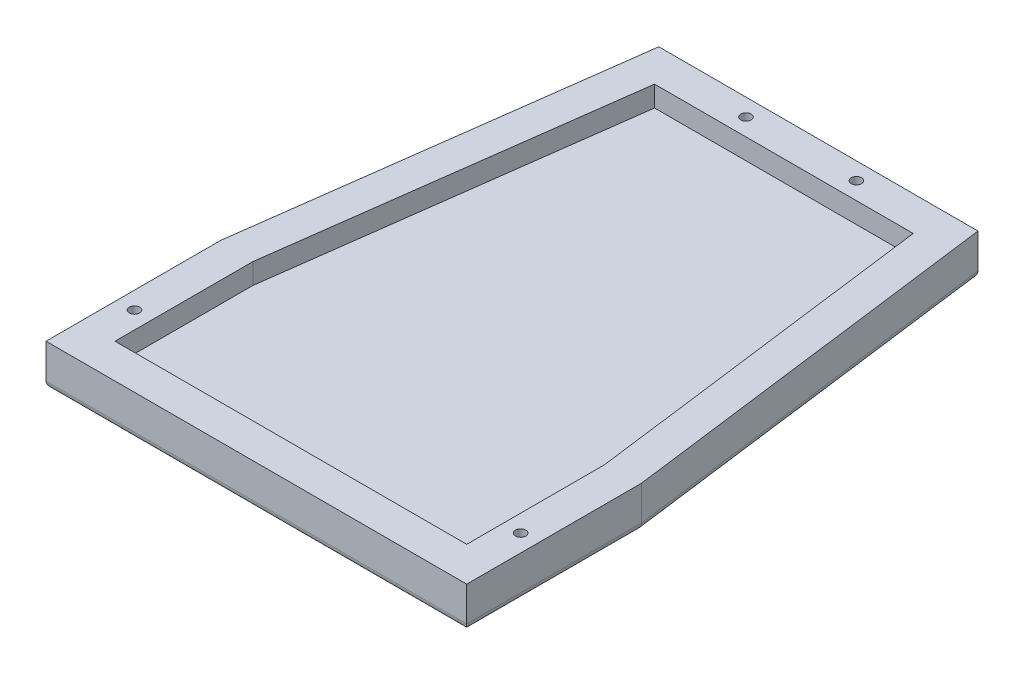
from build123d import *

# Parameters (mm, degrees)
DODANIE_WYCI_GNI_CIE1_DEPTH       = 3
WYCI_GNI_CIE_CIENKA_CIANKA1_DEPTH = 6
WYTNIJ_WYCI_GNI_CIE1_DEPTH        = 51
WYTNIJ_WYCI_GNI_CIE1_DEPTH_BACK   = 39
SZKIC5_R                          = 0.75
ZAOKR_GLENIE1_R                   = 1


with BuildPart() as part:
    # Szkic1 → Dodanie-wyciągnięcie1 (new body)
    with BuildSketch(Plane(origin=(0, 0, 0), x_dir=(1, 0, 0), z_dir=(0, 1, 0))):
        Polygon((-46.22519084, 44.98778626), (-0.22519084, 44.98778626), (7.27480916, -12.885496183), (7.27480916, -36.41221374), (-53.72519084, -36.41221374), (-53.72519084, -11.41221374), align=None)
    extrude(amount=DODANIE_WYCI_GNI_CIE1_DEPTH)

    # Szkic3 → Wyciągnięcie-cienka ścianka1 (add)
    with BuildSketch(Plane(origin=(0, 0, 0), x_dir=(1, 0, 0), z_dir=(0, 1, 0))):
        Polygon((7.27480916, -11.089579023), (0.007548313, 44.98778626), (-46.269205463, 44.98778626), (-53.72519084, -11.081223772), (-53.72519084, -36.41221374), (7.27480916, -36.41221374), align=None)
        Polygon((2.27480916, -11.41221374), (-4.386295649, 39.98778626), (-41.890084457, 39.98778626), (-48.72519084, -11.41221374), (-48.72519084, -31.41221374), (2.27480916, -31.41221374), align=None, mode=Mode.SUBTRACT)
    extrude(amount=WYCI_GNI_CIE_CIENKA_CIANKA1_DEPTH)

    # Szkic5 → Wytnij-wyciągnięcie1 (cut, two sides: drawn at the far end of the back side and taken through both)
    with BuildSketch(Plane(origin=(0, 6, 0), x_dir=(1, 0, 0), z_dir=(0, 1, 0)).offset(-WYTNIJ_WYCI_GNI_CIE1_DEPTH_BACK)):
        with Locations(Location((-31.129205463, 42.48778626, 0), (0, 0, 90))):
            Circle(SZKIC5_R)
        with Locations(Location((-15.129205463, 42.48778626, 0), (0, 0, 90))):
            Circle(SZKIC5_R)
        with Locations(Location((-51.22519084, -26.081223772, 0), (0, 0, 90))):
            Circle(SZKIC5_R)
        with Locations(Location((4.77480916, -26.089579023, 0), (0, 0, 90))):
            Circle(SZKIC5_R)
    extrude(amount=WYTNIJ_WYCI_GNI_CIE1_DEPTH + WYTNIJ_WYCI_GNI_CIE1_DEPTH_BACK, mode=Mode.SUBTRACT)

    # Zaokrąglenie1
    # the kernel refuses this fillet: 1 mm, written as the material it takes off along each edge
    with BuildSketch(Plane(origin=(-45.939659622, 0, -47.465970986), x_dir=(0, 1, 0), z_dir=(-0.13181833651416436, 0, 0.9912738905865718))) as zaokr_glenie1_piece_1:
        with BuildLine():
            CenterArc((ZAOKR_GLENIE1_R, -ZAOKR_GLENIE1_R), ZAOKR_GLENIE1_R, 90, 90)
            Line((0, -ZAOKR_GLENIE1_R), (0, 0))
            Line((0, 0), (ZAOKR_GLENIE1_R, 0))
        make_face()
    extrude(amount=61.562581305, mode=Mode.SUBTRACT)
    with BuildSketch(Plane(origin=(7.596106085, 0, 13.568846714), x_dir=(0, 1, 0), z_dir=(-0.12851876998328252, 0, -0.9917070765916638))) as zaokr_glenie1_piece_2:
        with BuildLine():
            CenterArc((ZAOKR_GLENIE1_R, -ZAOKR_GLENIE1_R), ZAOKR_GLENIE1_R, 90, 90)
            Line((0, -ZAOKR_GLENIE1_R), (0, 0))
            Line((0, 0), (ZAOKR_GLENIE1_R, 0))
        make_face()
    extrude(amount=61.546299413, mode=Mode.SUBTRACT)
    with BuildSketch(Plane(origin=(2.507548313, 0, -44.98778626), x_dir=(0, 1, 0), z_dir=(-1, 0, 0))) as zaokr_glenie1_piece_3:
        with BuildLine():
            CenterArc((ZAOKR_GLENIE1_R, -ZAOKR_GLENIE1_R), ZAOKR_GLENIE1_R, 90, 90)
            Line((0, -ZAOKR_GLENIE1_R), (0, 0))
            Line((0, 0), (ZAOKR_GLENIE1_R, 0))
        make_face()
    extrude(amount=51.276753776, mode=Mode.SUBTRACT)
    with BuildSketch(Plane(origin=(-51.22519084, 0, 26.081223772), x_dir=(0, 0, -1), z_dir=(1, 0, 0))) as zaokr_glenie1_piece_4:
        with BuildLine():
            CenterArc((0.75 + ZAOKR_GLENIE1_R, ZAOKR_GLENIE1_R), ZAOKR_GLENIE1_R, 180, 90)
            Line((0.75, ZAOKR_GLENIE1_R), (0.75, 0))
            Line((0.75, 0), (0.75 + ZAOKR_GLENIE1_R, 0))
        make_face()
    revolve(axis=Axis((-51.22519084, 0, 26.081223772), (0, 1, 0)), mode=Mode.SUBTRACT)
    with BuildSketch(Plane(origin=(4.77480916, 0, 26.089579023), x_dir=(0, 0, -1), z_dir=(1, 0, 0))) as zaokr_glenie1_piece_5:
        with BuildLine():
            CenterArc((0.75 + ZAOKR_GLENIE1_R, ZAOKR_GLENIE1_R), ZAOKR_GLENIE1_R, 180, 90)
            Line((0.75, ZAOKR_GLENIE1_R), (0.75, 0))
            Line((0.75, 0), (0.75 + ZAOKR_GLENIE1_R, 0))
        make_face()
    revolve(axis=Axis((4.77480916, 0, 26.089579023), (0, 1, 0)), mode=Mode.SUBTRACT)
    with BuildSketch(Plane(origin=(7.27480916, 0, 8.589579023), x_dir=(-1, 0, 0), z_dir=(0, 0, 1))) as zaokr_glenie1_piece_6:
        with BuildLine():
            CenterArc((ZAOKR_GLENIE1_R, -ZAOKR_GLENIE1_R), ZAOKR_GLENIE1_R, 90, 90)
            Line((0, -ZAOKR_GLENIE1_R), (0, 0))
            Line((0, 0), (ZAOKR_GLENIE1_R, 0))
        make_face()
    extrude(amount=30.322634717, mode=Mode.SUBTRACT)
    with BuildSketch(Plane(origin=(-15.129205463, 0, -42.48778626), x_dir=(0, 0, -1), z_dir=(1, 0, 0))) as zaokr_glenie1_piece_7:
        with BuildLine():
            CenterArc((0.75 + ZAOKR_GLENIE1_R, ZAOKR_GLENIE1_R), ZAOKR_GLENIE1_R, 180, 90)
            Line((0.75, ZAOKR_GLENIE1_R), (0.75, 0))
            Line((0.75, 0), (0.75 + ZAOKR_GLENIE1_R, 0))
        make_face()
    revolve(axis=Axis((-15.129205463, 0, -42.48778626), (0, 1, 0)), mode=Mode.SUBTRACT)
    with BuildSketch(Plane(origin=(9.77480916, 0, 36.41221374), x_dir=(0, 0, -1), z_dir=(-1, 0, 0))) as zaokr_glenie1_piece_8:
        with BuildLine():
            CenterArc((ZAOKR_GLENIE1_R, -ZAOKR_GLENIE1_R), ZAOKR_GLENIE1_R, 90, 90)
            Line((0, -ZAOKR_GLENIE1_R), (0, 0))
            Line((0, 0), (ZAOKR_GLENIE1_R, 0))
        make_face()
    extrude(amount=66, mode=Mode.SUBTRACT)
    with BuildSketch(Plane(origin=(-31.129205463, 0, -42.48778626), x_dir=(0, 0, -1), z_dir=(1, 0, 0))) as zaokr_glenie1_piece_9:
        with BuildLine():
            CenterArc((0.75 + ZAOKR_GLENIE1_R, ZAOKR_GLENIE1_R), ZAOKR_GLENIE1_R, 180, 90)
            Line((0.75, ZAOKR_GLENIE1_R), (0.75, 0))
            Line((0.75, 0), (0.75 + ZAOKR_GLENIE1_R, 0))
        make_face()
    revolve(axis=Axis((-31.129205463, 0, -42.48778626), (0, 1, 0)), mode=Mode.SUBTRACT)
    with BuildSketch(Plane(origin=(-53.72519084, 0, 38.91221374), x_dir=(1, 0, 0), z_dir=(0, 0, -1))) as zaokr_glenie1_piece_10:
        with BuildLine():
            CenterArc((ZAOKR_GLENIE1_R, -ZAOKR_GLENIE1_R), ZAOKR_GLENIE1_R, 90, 90)
            Line((0, -ZAOKR_GLENIE1_R), (0, 0))
            Line((0, 0), (ZAOKR_GLENIE1_R, 0))
        make_face()
    extrude(amount=30.330989969, mode=Mode.SUBTRACT)


solid = part.part
